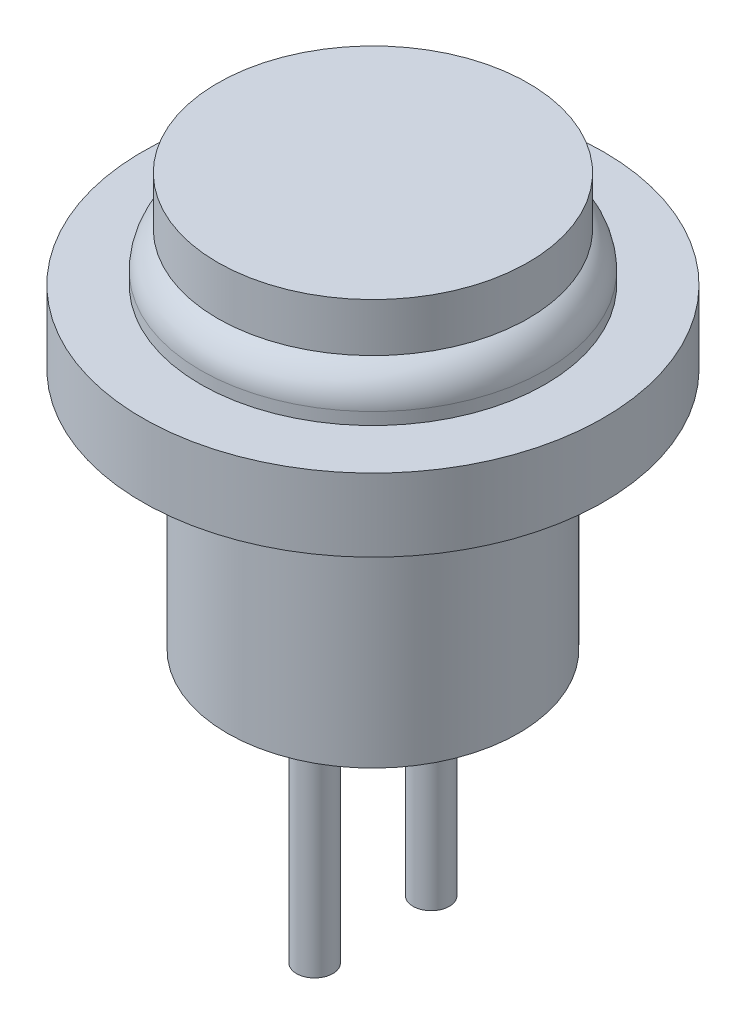
from build123d import *

# Parameters (mm, degrees)
SKETCH_1_R      = 7.1
EXTRUDE_1_DEPTH = 2
FILLET_1_R      = 1.5
SKETCH_2_R      = 6.4
EXTRUDE_2_DEPTH = 2
SKETCH_3_R      = 6
EXTRUDE_3_DEPTH = 13
SKETCH_4_R      = 0.75
EXTRUDE_4_DEPTH = 10
SKETCH_5_R      = 9.5
SKETCH_5_R_2    = 6
EXTRUDE_5_DEPTH = 3


with BuildPart() as part:
    # 草图1 → 拉伸1 (new body)
    with BuildSketch(Plane(origin=(0, 0, 0), x_dir=(1, 0, 0), z_dir=(0, 1, 0))):
        Circle(SKETCH_1_R)
    extrude(amount=EXTRUDE_1_DEPTH)

    # 圆角1
    fillet_1_edges = [part.edges().sort_by_distance(p)[0] for p in [
        (-7.1, 2, 0),
    ]]
    fillet(fillet_1_edges, radius=FILLET_1_R)

    # 草图2 → 拉伸2 (add)
    with BuildSketch(Plane(origin=(0, 2, 0), x_dir=(-1, 0, 0), z_dir=(0, 1, 0))):
        Circle(SKETCH_2_R)
    extrude(amount=EXTRUDE_2_DEPTH)

    # 草图3 → 拉伸3 (add)
    with BuildSketch(Plane.XZ):
        Circle(SKETCH_3_R)
    extrude(amount=EXTRUDE_3_DEPTH)

    # 草图4 → 拉伸4 (add)
    with BuildSketch(Plane.XZ.offset(13)):
        with Locations((0, -2.4)):
            Circle(SKETCH_4_R)
        with Locations((0, 2.4)):
            Circle(SKETCH_4_R)
    extrude(amount=EXTRUDE_4_DEPTH)

    # 草图5 → 拉伸5 (add)
    with BuildSketch(Plane.XZ):
        Circle(SKETCH_5_R)
        Circle(SKETCH_5_R_2, mode=Mode.SUBTRACT)
    extrude(amount=EXTRUDE_5_DEPTH)


solid = part.part
